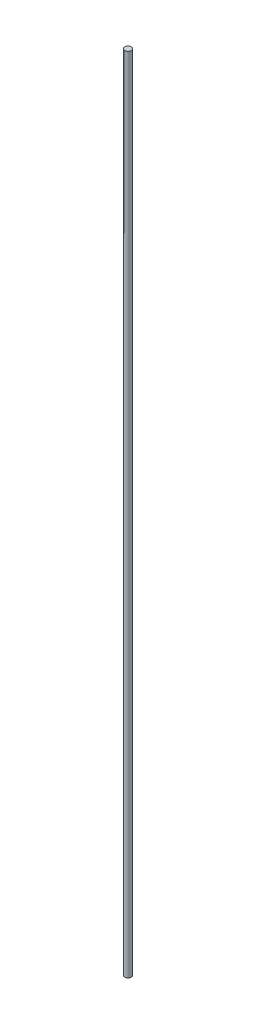
from build123d import *

# Parameters (mm, degrees)
SKETCH1_R           = 5.08
BOSS_EXTRUDE1_DEPTH = 1244.6


with BuildPart() as part:
    # Sketch1 → Boss-Extrude1 (new body)
    with BuildSketch(Plane(origin=(0, 0, 0), x_dir=(1, 0, 0), z_dir=(0, 1, 0))):
        Circle(SKETCH1_R)
    extrude(amount=BOSS_EXTRUDE1_DEPTH)


solid = part.part
